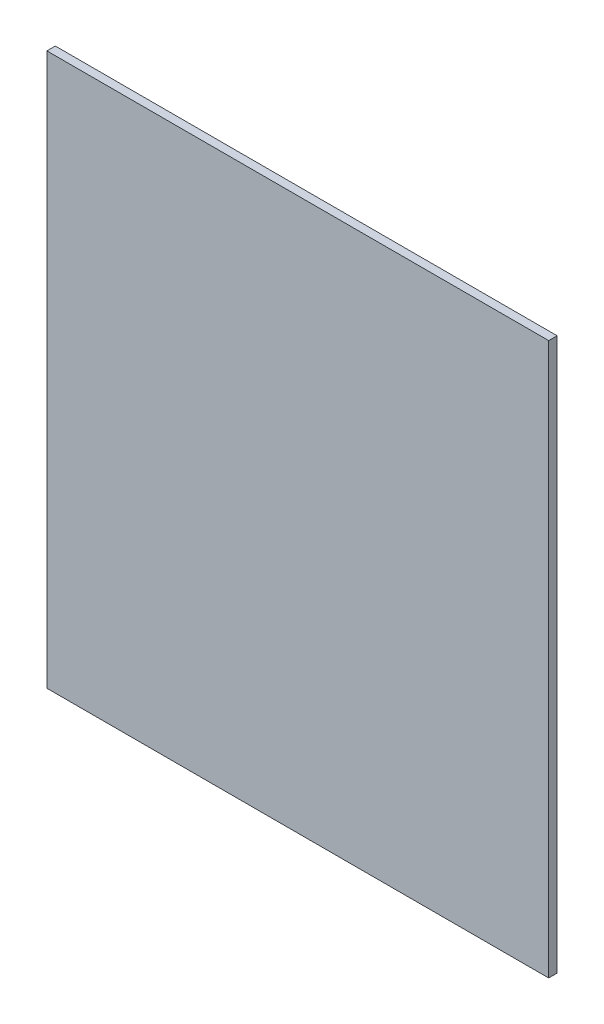
from build123d import *

# Parameters (mm, degrees)
SKETCH1_W           = 250
SKETCH1_H           = 275
BOSS_EXTRUDE1_DEPTH = 4.2


with BuildPart() as part:
    # Sketch1 → Boss-Extrude1 (new body)
    with BuildSketch(Plane.XY):
        with Locations((-95.228215768, -27.385892116)):
            Rectangle(SKETCH1_W, SKETCH1_H)
    extrude(amount=BOSS_EXTRUDE1_DEPTH)


solid = part.part
